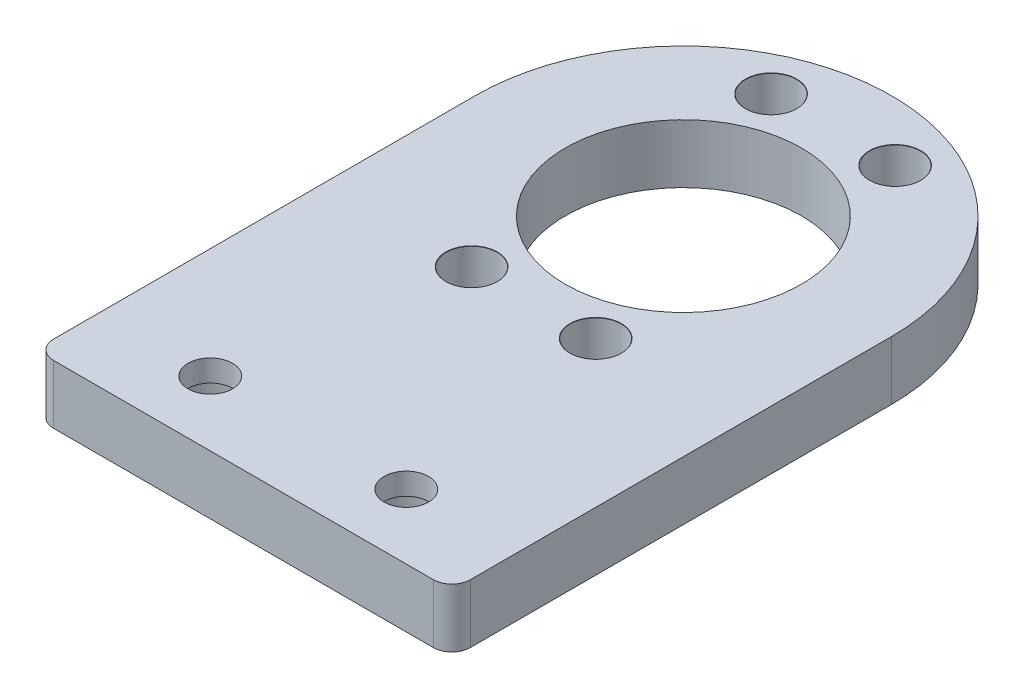
from build123d import *

# Parameters (mm, degrees)
BOSS_EXTRUDE1_DEPTH            = 6.35
M5_CLEARANCE_HOLE1_D           = 5.5
M5_CLEARANCE_HOLE1_CSINK_D     = 5.55
M5_CLEARANCE_HOLE1_CSINK_ANGLE = 90
SKETCH5_R                      = 12.75
CUT_EXTRUDE1_DEPTH             = 53.941689622
CBORE_FOR_M4_SHCS1_AT_2_COUNT  = 2
CBORE_FOR_M4_SHCS1_AT_2_PITCH  = 21.169571299
FILLET1_R                      = 2


with BuildPart() as part:
    # Sketch1 → Boss-Extrude1 (new body)
    with BuildSketch(Plane(origin=(0, 0, 0), x_dir=(1, 0, 0), z_dir=(0, 1, 0))):
        with BuildLine():
            Line((-22.5, -47.5), (22.5, -47.5))
            Line((22.5, -47.5), (22.5, 3.34e-07))
            ThreePointArc((22.5, 3.34e-07), (0, 22.5), (-22.5, 3.34e-07))
            Line((-22.5, 3.34e-07), (-22.5, -47.5))
        make_face()
    extrude(amount=BOSS_EXTRUDE1_DEPTH)

    # M5 Clearance Hole1 (through all)
    with Locations(Plane(origin=(0, 6.35, 0), x_dir=(1, 0, 0), z_dir=(0, 1, 0))):
        with Locations((-6.696960066, -16.167891819), (6.696960066, -16.167891819), (6.696960066, 16.167891819), (-6.696960066, 16.167891819)):
            CounterSinkHole(M5_CLEARANCE_HOLE1_D / 2, M5_CLEARANCE_HOLE1_CSINK_D / 2, counter_sink_angle=M5_CLEARANCE_HOLE1_CSINK_ANGLE)

    # Sketch5 → Cut-Extrude1 (cut, through all)
    with BuildSketch(Plane(origin=(0, 6.35, 0), x_dir=(1, 0, 0), z_dir=(0, 1, 0))):
        Circle(SKETCH5_R)
    extrude(amount=-CUT_EXTRUDE1_DEPTH, mode=Mode.SUBTRACT)

    # Sketch10 → CBORE for M4 SHCS1 (revolve, cut)
    with BuildSketch(Plane(origin=(10.584785649, 0, 40.5), x_dir=(0, 0, -1), z_dir=(1, 0, 0))):
        Polygon((0, 0), (0, 6.35), (2.4, 6.35), (2.4, 4), (4, 4), (4, 0.025), (4.025, 0), align=None)
    cbore_for_m4_shcs1 = revolve(axis=Axis((10.584785649, -6.35, 40.5), (0, 1, 0)), mode=Mode.SUBTRACT)

    # CBORE for M4 SHCS1 at 2: CBORE for M4 SHCS1 ×2
    with Locations(*[(-i * CBORE_FOR_M4_SHCS1_AT_2_PITCH, 0, 0) for i in range(1, CBORE_FOR_M4_SHCS1_AT_2_COUNT)]):
        add(cbore_for_m4_shcs1, mode=Mode.SUBTRACT)

    # Fillet1
    fillet1_edges = [part.edges().sort_by_distance(p)[0] for p in [
        (-22.5, 3.175, 47.5),
        (22.5, 3.175, 47.5),
    ]]
    fillet(fillet1_edges, radius=FILLET1_R)


solid = part.part
